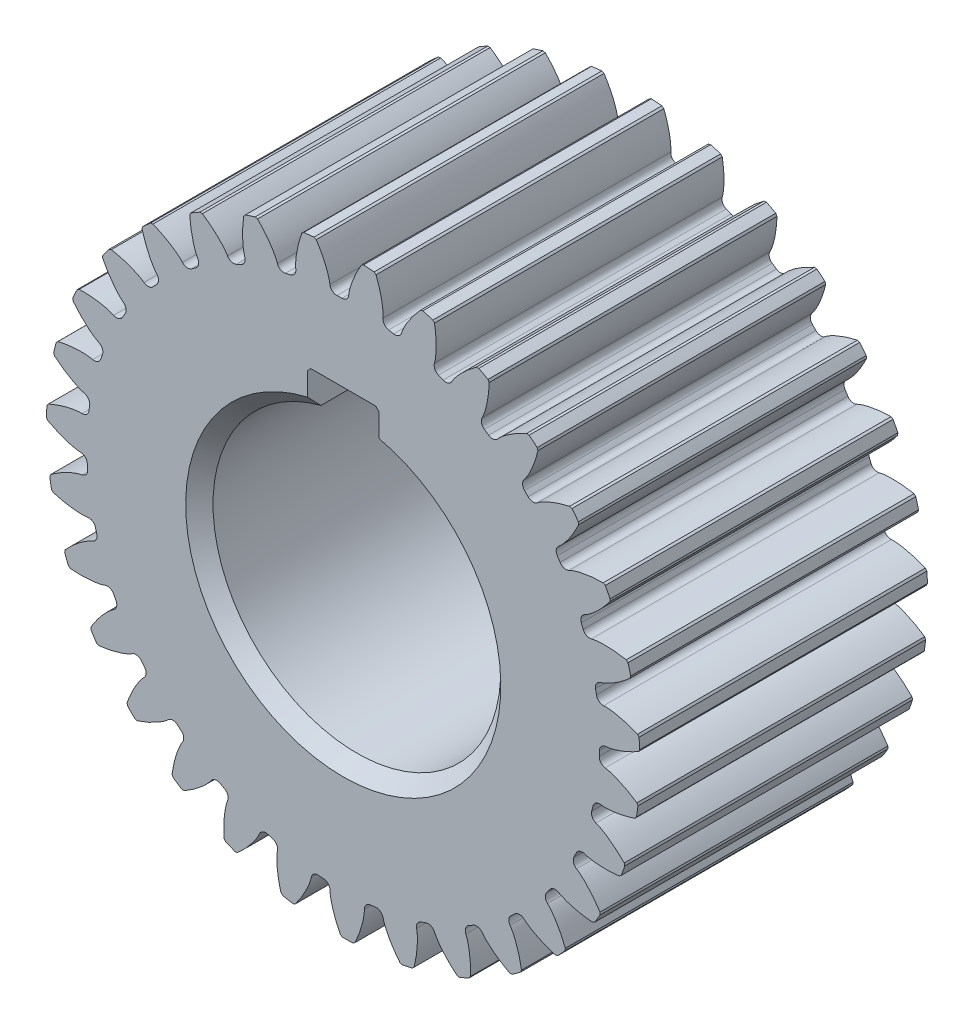
from build123d import *

# Parameters (mm, degrees)
SKETCH1_R                    = 35.625
BOSS_EXTRUDE1_DEPTH          = 40
BOSS_EXTRUDE2_DEPTH          = 40
CHAMFER1_SIZE                = 0.2
CIRPATTERN1_COUNT            = 31
CHAMFER1_OF_CIRPATTERN1_SIZE = 0.2
CHAMFER3_SIZE                = 0.5
CHAMFER4_SIZE                = 1.9
CHAMFER5_SIZE                = 1.5


with BuildPart() as part:
    # Sketch1 → Boss-Extrude1 (new body)
    with BuildSketch(Plane.XY):
        Circle(SKETCH1_R)
        with BuildLine():
            Line((5, 19.364916731), (5, 25))
            Line((5, 25), (-5, 25))
            Line((-5, 25), (-5, 19.364916731))
            ThreePointArc((-5, 19.364916731), (0, -20), (5, 19.364916731))
        make_face(mode=Mode.SUBTRACT)
    extrude(amount=BOSS_EXTRUDE1_DEPTH)

    # Sketch2 → Boss-Extrude2 (add)
    with BuildSketch(Plane.XY):
        with BuildLine():
            ThreePointArc((35.613134364, -0.919394228), (35.548433246, 2.334420437), (35.187065954, 5.568753411))
            ThreePointArc((35.187065954, 5.568753411), (35.531301489, 4.975929309), (36.184882177, 4.769118275))
            add(Edge.make_bspline(
                [(36.184882177, 4.769118275), (36.236762542, 4.772373712), (36.317358514, 4.775311796), (36.44079156, 4.776531759), (36.607171383, 4.772756088), (36.76437169, 4.765253238), (36.935662542, 4.752833986), (37.106749613, 4.736678514), (37.277571257, 4.717056878), (37.447854012, 4.694347989), (37.654225036, 4.663102522), (37.901805491, 4.620440158), (38.191275297, 4.563005664), (38.519609583, 4.488935398), (38.854150337, 4.4039028), (39.183225007, 4.312391426), (39.515461963, 4.210929441), (39.83673446, 4.106381979), (40.170044146, 3.988585469), (40.477513815, 3.875170682), (40.770768559, 3.758152717), (40.945823786, 3.686831643), (41.057175699, 3.639902396), (41.09033999, 3.625804673)],
                knots=[0.013503499, 0.013503499, 0.013503499, 0.013503499, 0.013503499, 0.04661014, 0.064854849, 0.092110526, 0.119476176, 0.146842496, 0.174208854, 0.201574956, 0.228941013, 0.256307345, 0.307035032, 0.361767352, 0.416499661, 0.471231937, 0.525964282, 0.580696616, 0.635428982, 0.690161387, 0.744893688, 0.799626082, 0.82211206, 0.82211206, 0.82211206, 0.82211206, 0.82211206], degree=4))
            ThreePointArc((41.09033999, 3.625804673), (41.161343758, 2.703013137), (41.211626442, 1.778860874))
            add(Edge.make_bspline(
                [(36.497810514, 0.00386179), (36.549671069, 0.007418888), (36.629959129, 0.015045854), (36.752491704, 0.02997814), (36.916948944, 0.055479461), (37.071818083, 0.083475515), (37.240013826, 0.118188419), (37.407518939, 0.15657881), (37.574307623, 0.198370887), (37.740158315, 0.243153233), (37.940671, 0.301118236), (38.180546194, 0.375791193), (38.460019201, 0.470587438), (38.775847411, 0.586959037), (39.096395208, 0.715010467), (39.41067661, 0.848770217), (39.726791864, 0.992808667), (40.031633321, 1.138472238), (40.346675969, 1.298845221), (40.636673522, 1.451494921), (40.912107023, 1.605857921), (41.076332015, 1.699459095), (41.180590566, 1.760547208), (41.211626442, 1.778860874)],
                knots=[0.013503499, 0.013503499, 0.013503499, 0.013503499, 0.013503499, 0.04661014, 0.064854849, 0.092110526, 0.119476176, 0.146842496, 0.174208854, 0.201574956, 0.228941013, 0.256307345, 0.307035032, 0.361767352, 0.416499661, 0.471231937, 0.525964282, 0.580696616, 0.635428982, 0.690161387, 0.744893688, 0.799626082, 0.82211206, 0.82211206, 0.82211206, 0.82211206, 0.82211206], degree=4))
            ThreePointArc((36.497810514, 0.00386179), (35.876888007, -0.286644249), (35.613134364, -0.919394228))
        make_face()
    boss_extrude2 = extrude(amount=BOSS_EXTRUDE2_DEPTH)

    # Chamfer1
    chamfer1_edges = [part.edges().sort_by_distance(p)[0] for p in [
        (41.211626442, 1.778860874, 20),
        (41.09033999, 3.625804673, 20),
    ]]
    chamfer(chamfer1_edges, length=CHAMFER1_SIZE - 0.0004)  # a hair under: the kernel refuses the full size

    # CirPattern1: Boss-Extrude2 ×31 about axis
    cirpattern1_axis = Axis((0, 0, 40), (0, 0, -1))
    for i in range(1, CIRPATTERN1_COUNT):
        add(boss_extrude2.rotate(cirpattern1_axis, i * 360 / CIRPATTERN1_COUNT))

    # Chamfer1 of CirPattern1
    chamfer1_of_cirpattern1_edges = [part.edges().sort_by_distance(p)[0] for p in [
        (40.726104089, -6.553391926, 20),
        (40.979087431, -4.719840391, 20),
        (38.57325025, -14.61734809, 20),
        (39.190146218, -12.872254636, 20),
        (34.841203013, -22.082868306, 20),
        (35.796755814, -20.497677263, 20),
        (29.682752831, -28.644313299, 20),
        (30.937842022, -27.283922575, 20),
        (23.309087261, -34.03305674, 20),
        (24.812329341, -32.95316089, 20),
        (15.981144919, -38.028482839, 20),
        (17.670996983, -37.273292927, 20),
        (7.998932627, -40.467018383, 20),
        (9.806211931, -40.067451972, 20),
        (-0.310756907, -41.24882944, 20),
        (1.539959411, -41.221244826, 20),
        (-8.607724016, -40.341908572, 20),
        (-6.789339228, -40.687435073, 20),
        (-16.552289893, -37.783385228, 20),
        (-14.840681522, -38.487876948, 20),
        (-23.819203077, -33.678005653, 20),
        (-22.28444457, -34.712620618, 20),
        (-30.110955288, -28.19384457, 20),
        (-28.81587984, -29.516225522, 20),
        (-35.169961452, -21.555424177, 20),
        (-34.167589603, -23.111432685, 20),
        (-38.789105262, -14.034522186, 20),
        (-38.120474233, -15.760455078, 20),
        (-40.820218544, -5.939045208, 20),
        (-40.512702169, -7.764242589, 20),
        (-41.180147284, 2.399576979, 20),
        (-41.246335318, 0.549838905, 20),
        (-39.854155955, 10.639960203, 20),
        (-40.291338653, 8.841409929, 20),
        (-36.896530799, 18.444742205, 20),
        (-37.68680985, 16.771012591, 20),
        (-32.428357336, 25.494394295, 20),
        (-33.539378623, 24.014008028, 20),
        (-26.632563114, 31.500302887, 20),
        (-28.018841295, 30.273867154, 20),
        (-19.746428629, 36.216585377, 20),
        (-21.351209312, 35.294310603, 20),
        (-12.051873036, 39.450156607, 20),
        (-13.809456311, 38.869800828, 20),
        (-3.863912345, 41.06863379, 20),
        (-5.702342547, 40.85395684, 20),
        (4.482237372, 41.005756281, 20),
        (2.638225792, 41.165547059, 20),
        (12.644883764, 39.264098291, 20),
        (10.870784857, 39.791814945, 20),
        (20.289847129, 35.914963504, 20),
        (18.658292712, 36.789001251, 20),
        (27.104141769, 31.095465891, 20),
        (25.681927871, 32.280041524, 20),
        (32.80878966, 25.002916251, 20),
        (31.654141886, 26.449533104, 20),
        (37.170241847, 17.886744282, 20),
        (36.330431613, 19.536177691, 20),
        (40.009939966, 10.038286901, 20),
        (39.519349201, 11.823008868, 20),
    ]]
    chamfer(chamfer1_of_cirpattern1_edges, length=CHAMFER1_OF_CIRPATTERN1_SIZE - 0.0004)  # a hair under: the kernel refuses the full size

    # Chamfer3
    chamfer3_edges = [part.edges().sort_by_distance(p)[0] for p in [
        (5, 25, 20),
        (-5, 25, 20),
    ]]
    chamfer(chamfer3_edges, length=CHAMFER3_SIZE)

    # Chamfer4
    chamfer4_edges = [part.edges().sort_by_distance(p)[0] for p in [
        (0, -20, 40),
    ]]
    chamfer(chamfer4_edges, length=CHAMFER4_SIZE)

    # Chamfer5
    chamfer5_edges = [part.edges().sort_by_distance(p)[0] for p in [
        (0, -20, 0),
    ]]
    chamfer(chamfer5_edges, length=CHAMFER5_SIZE)


solid = part.part
